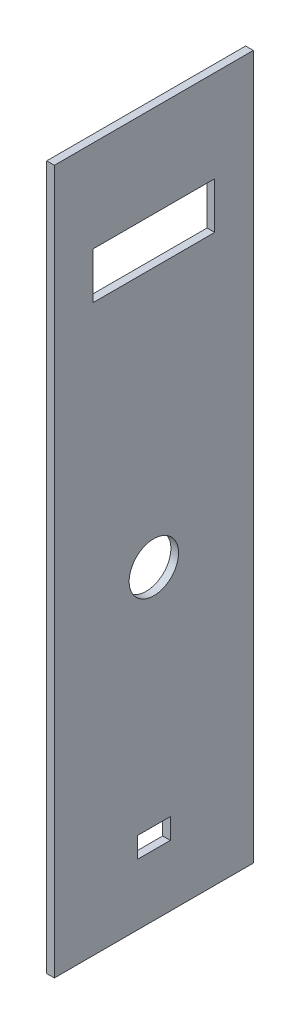
from build123d import *

# Parameters (mm, degrees)
SKETCH1_W           = 82.55
SKETCH1_H           = 292.1
BOSS_EXTRUDE1_DEPTH = 3.175
CUT_EXTRUDE1_REACH  = 305.557
SKETCH2_W           = 50.546
SKETCH2_H           = 19.304
CUT_EXTRUDE2_REACH  = 305.557
SKETCH4_R           = 10.25
CUT_EXTRUDE3_REACH  = 305.557
SKETCH5_W           = 13.7
SKETCH5_H           = 8.55


with BuildPart() as part:
    # Sketch1 → Boss-Extrude1 (new body)
    with BuildSketch(Plane(origin=(0, 0, 0), x_dir=(0, 0, -1), z_dir=(1, 0, 0))):
        with Locations((41.275, 146.05)):
            Rectangle(SKETCH1_W, SKETCH1_H)
    extrude(amount=BOSS_EXTRUDE1_DEPTH)

    # Sketch2 → Cut-Extrude1 (cut, up to next)
    with BuildSketch(Plane.ZY, mode=Mode.PRIVATE) as cut_extrude1_sk1:
        with Locations((-41.275, 244.348)):
            Rectangle(SKETCH2_W, SKETCH2_H)
    cut_extrude1_tool1 = extrude(cut_extrude1_sk1.sketch, amount=-CUT_EXTRUDE1_REACH, mode=Mode.PRIVATE) & part.part
    add(cut_extrude1_tool1.solids().sort_by_distance((0, 244.348, -41.275))[0], mode=Mode.SUBTRACT)

    # Sketch4 → Cut-Extrude2 (cut, up to next)
    with BuildSketch(Plane.ZY, mode=Mode.PRIVATE) as cut_extrude2_sk1:
        with Locations((-41.275, 127)):
            Circle(SKETCH4_R)
    cut_extrude2_tool1 = extrude(cut_extrude2_sk1.sketch, amount=-CUT_EXTRUDE2_REACH, mode=Mode.PRIVATE) & part.part
    add(cut_extrude2_tool1.solids().sort_by_distance((0, 127, -41.275))[0], mode=Mode.SUBTRACT)

    # Sketch5 → Cut-Extrude3 (cut, up to next)
    with BuildSketch(Plane.ZY, mode=Mode.PRIVATE) as cut_extrude3_sk1:
        with Locations((-41.275, 29.675)):
            Rectangle(SKETCH5_W, SKETCH5_H)
    cut_extrude3_tool1 = extrude(cut_extrude3_sk1.sketch, amount=-CUT_EXTRUDE3_REACH, mode=Mode.PRIVATE) & part.part
    add(cut_extrude3_tool1.solids().sort_by_distance((0, 29.675, -41.275))[0], mode=Mode.SUBTRACT)


solid = part.part
